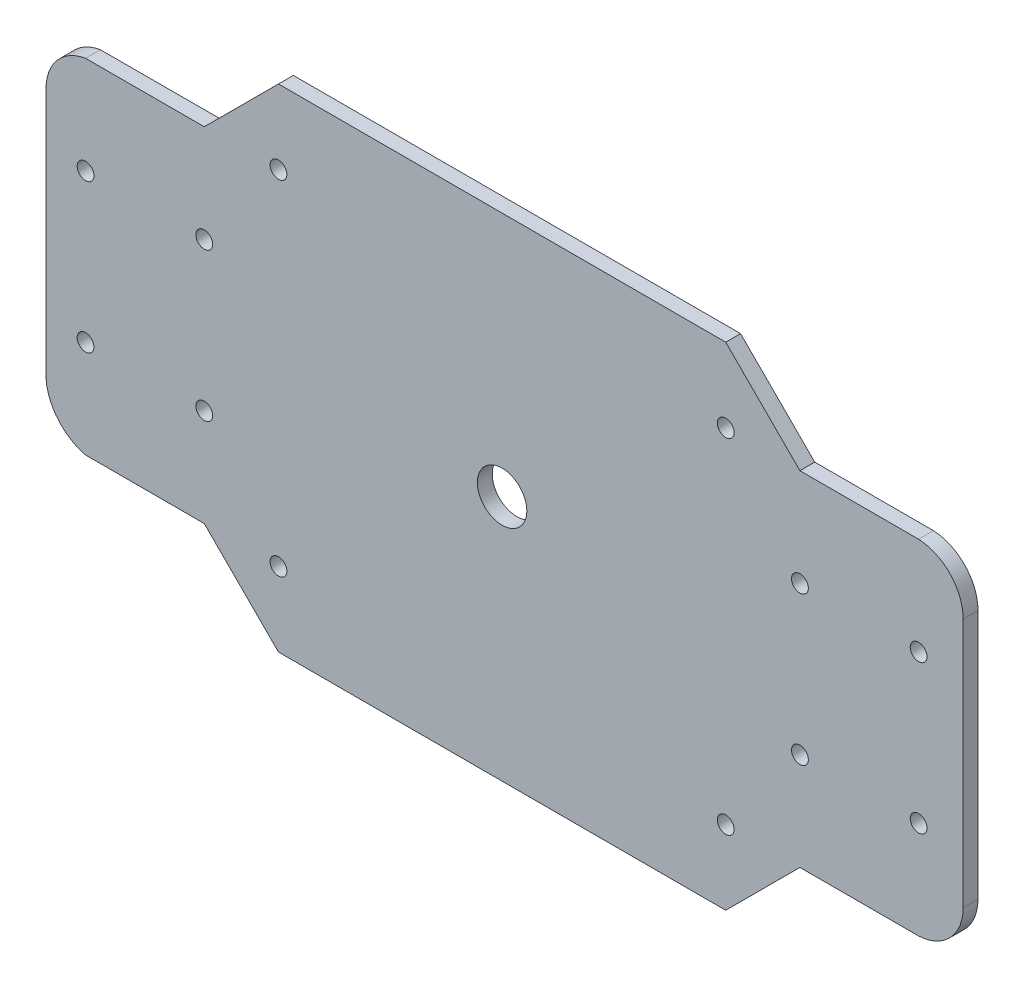
from build123d import *

# Parameters (mm, degrees)
SKETCH2_R           = 1.7
SKETCH2_R_2         = 5
BOSS_EXTRUDE4_DEPTH = 3


with BuildPart() as part:
    # Sketch2 → Boss-Extrude4 (new body)
    with BuildSketch(Plane.XY):
        with BuildLine():
            Line((-49.411099801, -41.712890537), (-34.411099801, -26.724072871))
            Line((-34.411099801, -26.724072871), (56.012900199, -26.724072871))
            Line((56.012900199, -26.724072871), (71.012900199, -41.724072871))
            Line((71.012900199, -41.724072871), (95.012900199, -41.724072871))
            ThreePointArc((95.012900199, -41.724072871), (101.421514455, -44.657805397), (104.017468813, -51.210525763))
            Line((104.017468813, -51.210525763), (104.012902501, -101.7536461))
            ThreePointArc((104.012902501, -101.7536461), (101.402317705, -108.274819675), (95.012900199, -111.193072871))
            Line((95.012900199, -111.193072871), (71.012900199, -111.193072871))
            Line((71.012900199, -111.193072871), (56.012900199, -126.193072871))
            Line((56.012900199, -126.193072871), (-34.411099801, -126.193072871))
            Line((-34.411099801, -126.193072871), (-49.411099801, -111.193072871))
            Line((-49.411099801, -111.193072871), (-73.411099801, -111.193072871))
            ThreePointArc((-73.411099801, -111.193072871), (-78.948916562, -107.77295051), (-81.411112957, -101.747816457))
            Line((-81.411112957, -101.747816457), (-81.411112957, -51.162112892))
            ThreePointArc((-81.411112957, -51.162112892), (-79.166649404, -44.95885915), (-73.411099801, -41.735255206))
            Line((-73.411099801, -41.735255206), (-49.411099801, -41.712890537))
        make_face()
        with Locations((-49.411099801, -61.458572871)):
            Circle(SKETCH2_R, mode=Mode.SUBTRACT)
        with Locations((-73.411099801, -61.458572871)):
            Circle(SKETCH2_R, mode=Mode.SUBTRACT)
        with Locations((-73.411099801, -91.458572871)):
            Circle(SKETCH2_R, mode=Mode.SUBTRACT)
        with Locations((-49.411099801, -91.458572871)):
            Circle(SKETCH2_R, mode=Mode.SUBTRACT)
        with Locations((95.012900199, -91.458572871)):
            Circle(SKETCH2_R, mode=Mode.SUBTRACT)
        with Locations((71.012900199, -91.458572871)):
            Circle(SKETCH2_R, mode=Mode.SUBTRACT)
        with Locations((95.012900199, -61.458572871)):
            Circle(SKETCH2_R, mode=Mode.SUBTRACT)
        with Locations((71.012900199, -61.458572871)):
            Circle(SKETCH2_R, mode=Mode.SUBTRACT)
        with Locations((10.800900199, -76.383042082)):
            Circle(SKETCH2_R_2, mode=Mode.SUBTRACT)
        with Locations((-34.411099801, -41.724072871)):
            Circle(SKETCH2_R, mode=Mode.SUBTRACT)
        with Locations((-34.411099801, -111.193072871)):
            Circle(SKETCH2_R, mode=Mode.SUBTRACT)
        with Locations((56.012900199, -111.193072871)):
            Circle(SKETCH2_R, mode=Mode.SUBTRACT)
        with Locations((56.012900199, -41.724072871)):
            Circle(SKETCH2_R, mode=Mode.SUBTRACT)
    extrude(amount=BOSS_EXTRUDE4_DEPTH)


solid = part.part
